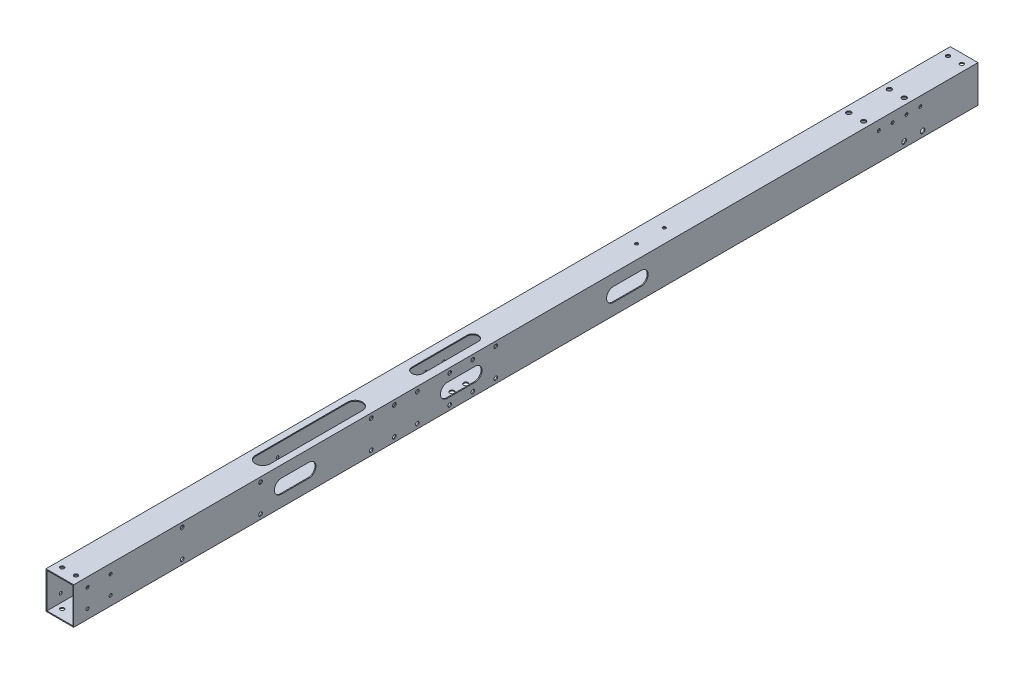
from build123d import *

# Parameters (mm, degrees)
SKETCH_1_W             = 30
SKETCH_1_H             = 40
SKETCH_1_W_2           = 28
SKETCH_1_H_2           = 38
EXTRUDE_1_DEPTH        = 940
SKETCH_5_R             = 2.5
CUT_EXTRUDE_3_DEPTH    = 941.97024395
CUT_EXTRUDE_4_DEPTH    = 1
SKETCH_7_R             = 1.5
CUT_EXTRUDE_5_DEPTH    = 1
SKETCH_17_W            = 30
SKETCH_17_H            = 40
SKETCH_17_W_2          = 28
SKETCH_17_H_2          = 38
EXTRUDE_2_DEPTH        = 20
SKETCH_18_W            = 30
SKETCH_18_H            = 40
SKETCH_18_W_2          = 28
SKETCH_18_H_2          = 38
EXTRUDE_3_DEPTH        = 20
SKETCH_19_R            = 2.1
CUT_EXTRUDE_16_DEPTH   = 961.950050731
SKETCH_20_R            = 1.6
CUT_EXTRUDE_17_DEPTH   = 961.67684473
SKETCH_21_R            = 2.5
SKETCH_21_R_2          = 1.6
CUT_EXTRUDE_18_DEPTH   = 961.67684473
SKETCH_23_R            = 2.5
CUT_EXTRUDE_19_DEPTH   = 961.950050731
SKETCH_24_R            = 4.5
CUT_EXTRUDE_20_DEPTH   = 10
SKETCH_26_R            = 2
CUT_EXTRUDE_22_DEPTH   = 961.67684473
CUT_EXTRUDE_28_DEPTH   = 10
PATTERN_LINEAR_4_COUNT = 2
PATTERN_LINEAR_4_PITCH = 255
PATTERN_LINEAR_8_COUNT = 2
PATTERN_LINEAR_8_PITCH = 205
PATTERN_LINEAR_9_COUNT = 2
PATTERN_LINEAR_9_PITCH = 230
CUT_EXTRUDE_START      = -20
SKETCH_34_R            = 1.75
CUT_EXTRUDE_29_DEPTH   = 20
SKETCH_35_R            = 1.5
CUT_EXTRUDE_30_DEPTH   = 10
CUT_EXTRUDE_31_DEPTH   = 10
SKETCH_37_R            = 1.65
CUT_EXTRUDE_32_DEPTH   = 3
SKETCH_39_R            = 1.75
CUT_EXTRUDE_33_DEPTH   = 10


with BuildPart() as part:
    # 草图1 → 凸台-拉伸1 (new body)
    with BuildSketch(Plane.XY):
        Rectangle(SKETCH_1_W, SKETCH_1_H)
        Rectangle(SKETCH_1_W_2, SKETCH_1_H_2, mode=Mode.SUBTRACT)
    extrude(amount=EXTRUDE_1_DEPTH)

    # 草图5 → 切除-拉伸3 (cut, through all)
    with BuildSketch(Plane.XZ.offset(20)):
        with Locations((-8, 53)):
            Circle(SKETCH_5_R)
        with Locations((8, 53)):
            Circle(SKETCH_5_R)
        with Locations((-8, 97)):
            Circle(SKETCH_5_R)
        with Locations((8, 97)):
            Circle(SKETCH_5_R)
    extrude(amount=-CUT_EXTRUDE_3_DEPTH, mode=Mode.SUBTRACT)

    # 草图6 → 切除-拉伸4 (cut)
    with BuildSketch(Plane(origin=(15, 0, 0), x_dir=(0, 0, -1), z_dir=(1, 0, 0))):
        with BuildLine():
            Line((-345, -7.5), (-375, -7.5))
            ThreePointArc((-375, -7.5), (-382.5, 0), (-375, 7.5))
            Line((-375, 7.5), (-345, 7.5))
            ThreePointArc((-345, 7.5), (-337.5, 0), (-345, -7.5))
        make_face()
        with BuildLine():
            Line((-525, -7.5), (-555, -7.5))
            ThreePointArc((-555, -7.5), (-562.5, 0), (-555, 7.5))
            Line((-555, 7.5), (-525, 7.5))
            ThreePointArc((-525, 7.5), (-517.5, 0), (-525, -7.5))
        make_face()
        with BuildLine():
            Line((-705, -7.5), (-735, -7.5))
            ThreePointArc((-735, -7.5), (-742.5, 0), (-735, 7.5))
            Line((-735, 7.5), (-705, 7.5))
            ThreePointArc((-705, 7.5), (-697.5, 0), (-705, -7.5))
        make_face()
    extrude(amount=-CUT_EXTRUDE_4_DEPTH, mode=Mode.SUBTRACT)

    # 草图7 → 切除-拉伸5 (cut)
    with BuildSketch(Plane.ZY.offset(15)):
        with Locations((350, 0)):
            Circle(SKETCH_7_R)
        with Locations((370, 0)):
            Circle(SKETCH_7_R)
        with Locations((530, 0)):
            Circle(SKETCH_7_R)
        with Locations((550, 0)):
            Circle(SKETCH_7_R)
        with Locations((710, 0)):
            Circle(SKETCH_7_R)
        with Locations((730, 0)):
            Circle(SKETCH_7_R)
    extrude(amount=-CUT_EXTRUDE_5_DEPTH, mode=Mode.SUBTRACT)

    # 草图17 → 凸台-拉伸2 (add)
    with BuildSketch(Plane.XY.offset(940)):
        Rectangle(SKETCH_17_W, SKETCH_17_H)
        Rectangle(SKETCH_17_W_2, SKETCH_17_H_2, mode=Mode.SUBTRACT)
    extrude(amount=EXTRUDE_2_DEPTH)

    # 草图18 → 凸台-拉伸3 (add)
    with BuildSketch(Plane(origin=(0, 0, 0), x_dir=(-1, 0, 0), z_dir=(0, 0, -1))):
        Rectangle(SKETCH_18_W, SKETCH_18_H)
        Rectangle(SKETCH_18_W_2, SKETCH_18_H_2, mode=Mode.SUBTRACT)
    extrude(amount=EXTRUDE_3_DEPTH)

    # 草图19 → 切除-拉伸16 (cut, through all)
    with BuildSketch(Plane(origin=(0, 20, 0), x_dir=(1, 0, 0), z_dir=(0, 1, 0))):
        with Locations((-7.5, -950)):
            Circle(SKETCH_19_R)
        with Locations((7.5, -950)):
            Circle(SKETCH_19_R)
        with Locations((-7.5, 10)):
            Circle(SKETCH_19_R)
        with Locations((7.5, 10)):
            Circle(SKETCH_19_R)
    extrude(amount=-CUT_EXTRUDE_16_DEPTH, mode=Mode.SUBTRACT)

    # 草图20 → 切除-拉伸17 (cut, through all)
    with BuildSketch(Plane(origin=(15, 0, 0), x_dir=(0, 0, -1), z_dir=(1, 0, 0))):
        with Locations((-945, 10)):
            Circle(SKETCH_20_R)
        with Locations((-920, 10)):
            Circle(SKETCH_20_R)
        with Locations((-920, -10)):
            Circle(SKETCH_20_R)
        with Locations((-945, -10)):
            Circle(SKETCH_20_R)
    extrude(amount=-CUT_EXTRUDE_17_DEPTH, mode=Mode.SUBTRACT)

    # 草图21 → 切除-拉伸18 (cut, through all)
    with BuildSketch(Plane(origin=(15, 0, 0), x_dir=(0, 0, -1), z_dir=(1, 0, 0))):
        with Locations((-40, -14)):
            Circle(SKETCH_21_R)
        with Locations((-60, -14)):
            Circle(SKETCH_21_R)
        with Locations((-42.5, 10)):
            Circle(SKETCH_21_R_2)
        with Locations((-57.5, 10)):
            Circle(SKETCH_21_R_2)
        with Locations((-72.5, 10)):
            Circle(SKETCH_21_R_2)
        with Locations((-87.5, 10)):
            Circle(SKETCH_21_R_2)
    extrude(amount=-CUT_EXTRUDE_18_DEPTH, mode=Mode.SUBTRACT)

    # 草图23 → 切除-拉伸19 (cut, through all)
    with BuildSketch(Plane(origin=(0, 20, 0), x_dir=(1, 0, 0), z_dir=(0, 1, 0))):
        with Locations((0, -520)):
            Circle(SKETCH_23_R)
        with Locations((0, -535)):
            Circle(SKETCH_23_R)
        with Locations((0, -550)):
            Circle(SKETCH_23_R)
        with Locations((0, -565)):
            Circle(SKETCH_23_R)
    extrude(amount=-CUT_EXTRUDE_19_DEPTH, mode=Mode.SUBTRACT)

    # 草图24 → 切除-拉伸20 (cut)
    with BuildSketch(Plane(origin=(0, 20, 0), x_dir=(1, 0, 0), z_dir=(0, 1, 0))):
        with Locations((0, -520)):
            Circle(SKETCH_24_R)
        with Locations((0, -535)):
            Circle(SKETCH_24_R)
        with Locations((0, -550)):
            Circle(SKETCH_24_R)
        with Locations((0, -565)):
            Circle(SKETCH_24_R)
    extrude(amount=-CUT_EXTRUDE_20_DEPTH, mode=Mode.SUBTRACT)

    # 草图26 → 切除-拉伸22 (cut, through all)
    with BuildSketch(Plane(origin=(15, 0, 0), x_dir=(0, 0, -1), z_dir=(1, 0, 0))):
        with Locations((-842.5, 15)):
            Circle(SKETCH_26_R)
        with Locations((-842.5, -15)):
            Circle(SKETCH_26_R)
        with Locations((-757.5, -15)):
            Circle(SKETCH_26_R)
        with Locations((-757.5, 15)):
            Circle(SKETCH_26_R)
    cut_extrude_22 = extrude(amount=-CUT_EXTRUDE_22_DEPTH, mode=Mode.SUBTRACT)

    # 草图33 → 切除-拉伸28 (cut)
    with BuildSketch(Plane(origin=(0, 20, 0), x_dir=(1, 0, 0), z_dir=(0, 1, 0))):
        with BuildLine():
            Line((6, -512.5), (6, -572.5))
            ThreePointArc((6, -572.5), (0, -578.5), (-6, -572.5))
            Line((-6, -572.5), (-6, -512.5))
            ThreePointArc((-6, -512.5), (0, -506.5), (6, -512.5))
        make_face()
    extrude(amount=-CUT_EXTRUDE_28_DEPTH, mode=Mode.SUBTRACT)

    # 阵列(线性)4: 切除-拉伸22 ×2
    with Locations(*[(0, 0, -i * PATTERN_LINEAR_4_PITCH) for i in range(1, PATTERN_LINEAR_4_COUNT)]):
        add(cut_extrude_22, mode=Mode.SUBTRACT)

    # 阵列(线性)8: 切除-拉伸22 ×2
    with Locations(*[(0, 0, -i * PATTERN_LINEAR_8_PITCH) for i in range(1, PATTERN_LINEAR_8_COUNT)]):
        add(cut_extrude_22, mode=Mode.SUBTRACT)

    # 阵列(线性)9: 切除-拉伸22 ×2
    with Locations(*[(0, 0, -i * PATTERN_LINEAR_9_PITCH) for i in range(1, PATTERN_LINEAR_9_COUNT)]):
        add(cut_extrude_22, mode=Mode.SUBTRACT)

    # 草图34 → 切除-拉伸29 (cut)
    with BuildSketch(Plane(origin=(15, 0, 0), x_dir=(0, 0, -1), z_dir=(1, 0, 0)).offset(CUT_EXTRUDE_START)):
        with Locations((-935, 0)):
            Circle(SKETCH_34_R)
        with Locations((-915, 0)):
            Circle(SKETCH_34_R)
    extrude(amount=-CUT_EXTRUDE_29_DEPTH, mode=Mode.SUBTRACT)

    # 草图35 → 切除-拉伸30 (cut)
    with BuildSketch(Plane.XZ.offset(20)):
        with Locations((5, 720)):
            Circle(SKETCH_35_R)
        with Locations((5, 700)):
            Circle(SKETCH_35_R)
        with Locations((5, 680)):
            Circle(SKETCH_35_R)
        with Locations((5, 660)):
            Circle(SKETCH_35_R)
        with Locations((5, 640)):
            Circle(SKETCH_35_R)
        with Locations((5, 740)):
            Circle(SKETCH_35_R)
    extrude(amount=-CUT_EXTRUDE_30_DEPTH, mode=Mode.SUBTRACT)

    # 草图36 → 切除-拉伸31 (cut)
    with BuildSketch(Plane(origin=(0, 20, 0), x_dir=(1, 0, 0), z_dir=(0, 1, 0))):
        with BuildLine():
            Line((8, -640), (8, -740))
            ThreePointArc((8, -740), (0, -748), (-8, -740))
            Line((-8, -740), (-8, -640))
            ThreePointArc((-8, -640), (0, -632), (8, -640))
        make_face()
    extrude(amount=-CUT_EXTRUDE_31_DEPTH, mode=Mode.SUBTRACT)

    # 草图37 → 切除-拉伸32 (cut)
    with BuildSketch(Plane(origin=(0, 20, 0), x_dir=(1, 0, 0), z_dir=(0, 1, 0))):
        with Locations((0, -305)):
            Circle(SKETCH_37_R)
        with Locations((0, -335)):
            Circle(SKETCH_37_R)
    extrude(amount=-CUT_EXTRUDE_32_DEPTH, mode=Mode.SUBTRACT)

    # 草图39 → 切除-拉伸33 (cut)
    with BuildSketch(Plane.XZ.offset(20)):
        with Locations((0, 117)):
            Circle(SKETCH_39_R)
        with Locations((0, 137)):
            Circle(SKETCH_39_R)
    extrude(amount=-CUT_EXTRUDE_33_DEPTH, mode=Mode.SUBTRACT)


solid = part.part
